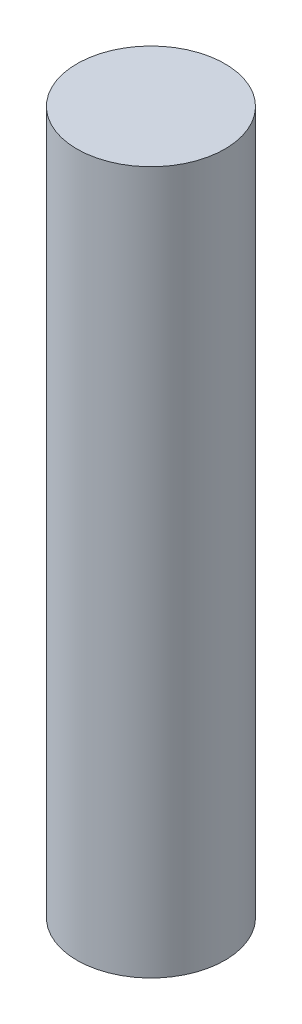
from build123d import *

# Parameters (mm, degrees)
CROQUIS1_R              = 4
SALIENTE_EXTRUIR1_DEPTH = 38


with BuildPart() as part:
    # Croquis1 → Saliente-Extruir1 (new body)
    with BuildSketch(Plane(origin=(0, 0, 0), x_dir=(1, 0, 0), z_dir=(0, 1, 0))):
        Circle(CROQUIS1_R)
    extrude(amount=SALIENTE_EXTRUIR1_DEPTH)


solid = part.part
